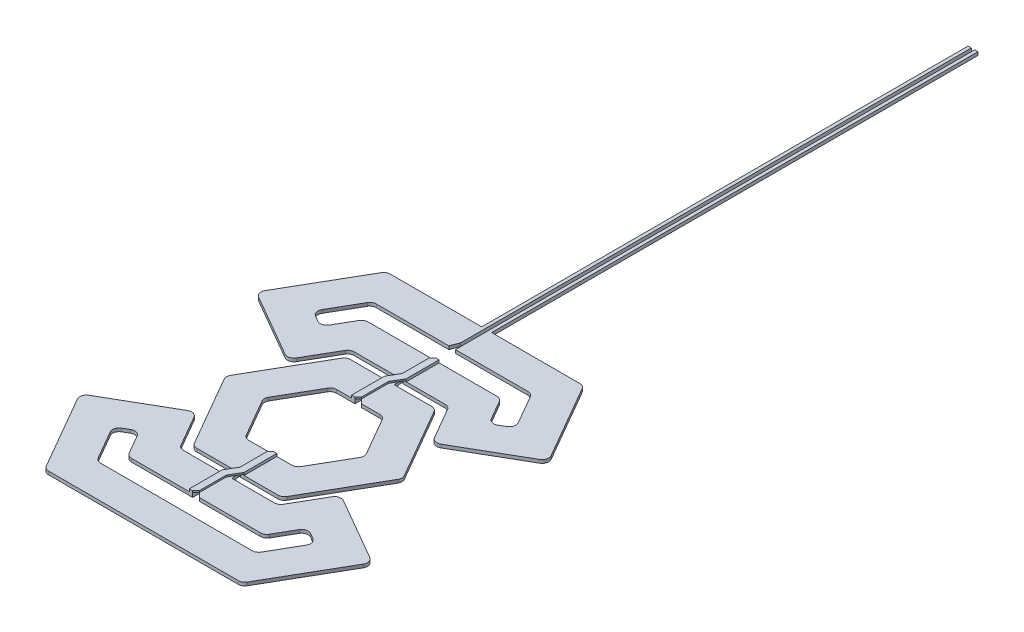
from build123d import *

# Parameters (mm, degrees)
EXTRUDE_1_DEPTH          = 1
EXTRUDE_1_2_DEPTH        = 1
EXTRUDE_1_3_DEPTH        = 1
CUT_EXTRUDE_2_DEPTH      = 3
CUT_EXTRUDE_2_DEPTH_BACK = 3
SKETCH_2_W               = 2
SKETCH_2_H               = 113.811945541
EXTRUDE_3_DEPTH          = 1
EXTRUDE_4_OUTLINE_W      = 1
EXTRUDE_4_OUTLINE_H      = 10
EXTRUDE_4_DEPTH          = 0.8
EXTRUDE_4_2_OUTLINE_W    = 1
EXTRUDE_4_2_OUTLINE_H    = 10
EXTRUDE_4_2_DEPTH        = 0.8
EXTRUDE_4_3_OUTLINE_W    = 1
EXTRUDE_4_3_OUTLINE_H    = 10
EXTRUDE_4_3_DEPTH        = 0.8
EXTRUDE_5_DEPTH          = 0.5
EXTRUDE_6_DEPTH          = 1
EXTRUDE_6_2_OUTLINE_W    = 1
EXTRUDE_6_2_OUTLINE_H    = 148.038475773
EXTRUDE_6_2_DEPTH        = 1


# Read off the part's stored shape, not the designer's step: 凸台-拉伸4, 凸台-拉伸6
with BuildPart() as part:
    # 草图1 → 凸台-拉伸1 (new body)
    with BuildSketch(Plane(origin=(0, 0, 0), x_dir=(1, 0, 0), z_dir=(0, 1, 0))):
        with BuildLine():
            Line((21, 15.588457268), (15.577350269, 24.980762114))
            ThreePointArc((15.577350269, 24.980762114), (14.845299462, 25.712812921), (13.845299462, 25.980762114))
            Line((13.845299462, 25.980762114), (-13.845299462, 25.980762114))
            ThreePointArc((-13.845299462, 25.980762114), (-14.845299462, 25.712812921), (-15.577350269, 24.980762114))
            Line((-15.577350269, 24.980762114), (-21, 15.588457268))
            ThreePointArc((-21, 15.588457268), (-22.214412717, 14.656605616), (-23.732050808, 14.856406461))
            Line((-23.732050808, 14.856406461), (-42.767949192, 25.846787517))
            ThreePointArc((-42.767949192, 25.846787517), (-43.699800845, 27.061200235), (-43.5, 28.578838325))
            Line((-43.5, 28.578838325), (-30.577350269, 50.961524227))
            ThreePointArc((-30.577350269, 50.961524227), (-29.845299462, 51.693575035), (-28.845299462, 51.961524227))
            Line((-28.845299462, 51.961524227), (28.845299462, 51.961524227))
            ThreePointArc((28.845299462, 51.961524227), (29.845299462, 51.693575035), (30.577350269, 50.961524227))
            Line((30.577350269, 50.961524227), (43.5, 28.578838325))
            ThreePointArc((43.5, 28.578838325), (43.699800845, 27.061200235), (42.767949192, 25.846787517))
            Line((42.767949192, 25.846787517), (23.732050808, 14.856406461))
            ThreePointArc((23.732050808, 14.856406461), (22.214412717, 14.656605616), (21, 15.588457268))
        make_face()
        with BuildLine():
            Line((23.07179677, 41.961524227), (-23.07179677, 41.961524227))
            ThreePointArc((-23.07179677, 41.961524227), (-24.07179677, 41.693575035), (-24.803847577, 40.961524227))
            Line((-24.803847577, 40.961524227), (-29.839745962, 32.239092363))
            ThreePointArc((-29.839745962, 32.239092363), (-30.039546807, 30.721454273), (-29.107695155, 29.507041555))
            Line((-29.107695155, 29.507041555), (-27.392304845, 28.516660498))
            ThreePointArc((-27.392304845, 28.516660498), (-25.874666755, 28.316859653), (-24.660254038, 29.248711306))
            Line((-24.660254038, 29.248711306), (-21.350852961, 34.980762114))
            ThreePointArc((-21.350852961, 34.980762114), (-20.618802154, 35.712812921), (-19.618802154, 35.980762114))
            Line((-19.618802154, 35.980762114), (19.618802154, 35.980762114))
            ThreePointArc((19.618802154, 35.980762114), (20.618802154, 35.712812921), (21.350852961, 34.980762114))
            Line((21.350852961, 34.980762114), (24.660254038, 29.248711306))
            ThreePointArc((24.660254038, 29.248711306), (25.874666755, 28.316859653), (27.392304845, 28.516660498))
            Line((27.392304845, 28.516660498), (29.107695155, 29.507041555))
            ThreePointArc((29.107695155, 29.507041555), (30.039546807, 30.721454273), (29.839745962, 32.239092363))
            Line((29.839745962, 32.239092363), (24.803847577, 40.961524227))
            ThreePointArc((24.803847577, 40.961524227), (24.07179677, 41.693575035), (23.07179677, 41.961524227))
        make_face(mode=Mode.SUBTRACT)
    extrude(amount=EXTRUDE_1_DEPTH)


with BuildPart() as body_2:
    # 草图1 → Extrude 1 2 (new body)
    with BuildSketch(Plane(origin=(0, 0, 0), x_dir=(1, 0, 0), z_dir=(0, 1, 0))):
        with BuildLine():
            Line((-43.5, -28.578838325), (-30.577350269, -50.961524227))
            ThreePointArc((-30.577350269, -50.961524227), (-29.845299462, -51.693575035), (-28.845299462, -51.961524227))
            Line((-28.845299462, -51.961524227), (28.845299462, -51.961524227))
            ThreePointArc((28.845299462, -51.961524227), (29.845299462, -51.693575035), (30.577350269, -50.961524227))
            Line((30.577350269, -50.961524227), (43.5, -28.578838325))
            ThreePointArc((43.5, -28.578838325), (43.699800845, -27.061200235), (42.767949192, -25.846787517))
            Line((42.767949192, -25.846787517), (23.732050808, -14.856406461))
            ThreePointArc((23.732050808, -14.856406461), (22.214412717, -14.656605616), (21, -15.588457268))
            Line((21, -15.588457268), (15.577350269, -24.980762114))
            ThreePointArc((15.577350269, -24.980762114), (14.845299462, -25.712812921), (13.845299462, -25.980762114))
            Line((13.845299462, -25.980762114), (-13.845299462, -25.980762114))
            ThreePointArc((-13.845299462, -25.980762114), (-14.845299462, -25.712812921), (-15.577350269, -24.980762114))
            Line((-15.577350269, -24.980762114), (-21, -15.588457268))
            ThreePointArc((-21, -15.588457268), (-22.214412717, -14.656605616), (-23.732050808, -14.856406461))
            Line((-23.732050808, -14.856406461), (-42.767949192, -25.846787517))
            ThreePointArc((-42.767949192, -25.846787517), (-43.699800845, -27.061200235), (-43.5, -28.578838325))
        make_face()
        with BuildLine():
            Line((-29.839745962, -32.239092363), (-24.803847577, -40.961524227))
            ThreePointArc((-24.803847577, -40.961524227), (-24.07179677, -41.693575035), (-23.07179677, -41.961524227))
            Line((-23.07179677, -41.961524227), (23.07179677, -41.961524227))
            ThreePointArc((23.07179677, -41.961524227), (24.07179677, -41.693575035), (24.803847577, -40.961524227))
            Line((24.803847577, -40.961524227), (29.839745962, -32.239092363))
            ThreePointArc((29.839745962, -32.239092363), (30.039546807, -30.721454273), (29.107695155, -29.507041555))
            Line((29.107695155, -29.507041555), (27.392304845, -28.516660498))
            ThreePointArc((27.392304845, -28.516660498), (25.874666755, -28.316859653), (24.660254038, -29.248711306))
            Line((24.660254038, -29.248711306), (21.350852961, -34.980762114))
            ThreePointArc((21.350852961, -34.980762114), (20.618802154, -35.712812921), (19.618802154, -35.980762114))
            Line((19.618802154, -35.980762114), (-19.618802154, -35.980762114))
            ThreePointArc((-19.618802154, -35.980762114), (-20.618802154, -35.712812921), (-21.350852961, -34.980762114))
            Line((-21.350852961, -34.980762114), (-24.660254038, -29.248711306))
            ThreePointArc((-24.660254038, -29.248711306), (-25.874666755, -28.316859653), (-27.392304845, -28.516660498))
            Line((-27.392304845, -28.516660498), (-29.107695155, -29.507041555))
            ThreePointArc((-29.107695155, -29.507041555), (-30.039546807, -30.721454273), (-29.839745962, -32.239092363))
        make_face(mode=Mode.SUBTRACT)
    extrude(amount=EXTRUDE_1_2_DEPTH)


with BuildPart() as body_3:
    # 草图1 → Extrude 1 3 (new body)
    with BuildSketch(Plane(origin=(0, 0, 0), x_dir=(1, 0, 0), z_dir=(0, 1, 0))):
        with BuildLine():
            Line((26.422649731, 1), (14.077350269, 22.382685902))
            ThreePointArc((14.077350269, 22.382685902), (13.345299462, 23.11473671), (12.345299462, 23.382685902))
            Line((12.345299462, 23.382685902), (-12.345299462, 23.382685902))
            ThreePointArc((-12.345299462, 23.382685902), (-13.345299462, 23.11473671), (-14.077350269, 22.382685902))
            Line((-14.077350269, 22.382685902), (-26.422649731, 1))
            ThreePointArc((-26.422649731, 1), (-26.690598923, 0), (-26.422649731, -1))
            Line((-26.422649731, -1), (-14.077350269, -22.382685902))
            ThreePointArc((-14.077350269, -22.382685902), (-13.345299462, -23.11473671), (-12.345299462, -23.382685902))
            Line((-12.345299462, -23.382685902), (12.345299462, -23.382685902))
            ThreePointArc((12.345299462, -23.382685902), (13.345299462, -23.11473671), (14.077350269, -22.382685902))
            Line((14.077350269, -22.382685902), (26.422649731, -1))
            ThreePointArc((26.422649731, -1), (26.690598923, 0), (26.422649731, 1))
        make_face()
        with BuildLine():
            Line((6.57179677, 13.382685902), (-6.57179677, 13.382685902))
            ThreePointArc((-6.57179677, 13.382685902), (-7.57179677, 13.11473671), (-8.303847577, 12.382685902))
            Line((-8.303847577, 12.382685902), (-14.875644347, 1))
            ThreePointArc((-14.875644347, 1), (-15.143593539, 0), (-14.875644347, -1))
            Line((-14.875644347, -1), (-8.303847577, -12.382685902))
            ThreePointArc((-8.303847577, -12.382685902), (-7.57179677, -13.11473671), (-6.57179677, -13.382685902))
            Line((-6.57179677, -13.382685902), (6.57179677, -13.382685902))
            ThreePointArc((6.57179677, -13.382685902), (7.57179677, -13.11473671), (8.303847577, -12.382685902))
            Line((8.303847577, -12.382685902), (14.875644347, -1))
            ThreePointArc((14.875644347, -1), (15.143593539, 0), (14.875644347, 1))
            Line((14.875644347, 1), (8.303847577, 12.382685902))
            ThreePointArc((8.303847577, 12.382685902), (7.57179677, 13.11473671), (6.57179677, 13.382685902))
        make_face(mode=Mode.SUBTRACT)
    extrude(amount=EXTRUDE_1_3_DEPTH)


with BuildPart() as cut_extrude_2_tool:
    # 草图2 → 切除-拉伸2 (new, two sides: drawn at the far end of the back side and taken through both)
    with BuildSketch(Plane(origin=(0, 0, 0), x_dir=(1, 0, 0), z_dir=(0, 1, 0)).offset(-CUT_EXTRUDE_2_DEPTH_BACK)):
        with Locations((0, 18.094027229)):
            Rectangle(SKETCH_2_W, SKETCH_2_H)
    extrude(amount=CUT_EXTRUDE_2_DEPTH + CUT_EXTRUDE_2_DEPTH_BACK)


with BuildPart() as part_1:
    add(part.part)

    # 切除-拉伸2: cut by cut_extrude_2_tool
    add(cut_extrude_2_tool.part, mode=Mode.SUBTRACT)



with BuildPart() as body_2_1:
    add(body_2.part)

    # 切除-拉伸2: cut by cut_extrude_2_tool
    add(cut_extrude_2_tool.part, mode=Mode.SUBTRACT)


with BuildPart() as body_3_1:
    add(body_3.part)

    # 切除-拉伸2: cut by cut_extrude_2_tool
    add(cut_extrude_2_tool.part, mode=Mode.SUBTRACT)


with BuildPart() as part_2:
    add(part_1.part)

    add(body_2_1.part)  # 凸台-拉伸3 merges body 2

    add(body_3_1.part)  # 凸台-拉伸3 merges body 3
    # 草图4 → 凸台-拉伸3 (add)
    with BuildSketch(Plane(origin=(0, 0, 0), x_dir=(1, 0, 0), z_dir=(0, 1, 0))):
        with BuildLine():
            Line((-1, 35.980762114), (0.31908507, 34.661677043))
            ThreePointArc((0.31908507, 34.661677043), (0.535857822, 34.337253695), (0.611978289, 33.954570262))
            Line((0.611978289, 33.954570262), (0.611978289, 25.696711517))
            ThreePointArc((0.611978289, 25.696711517), (0.615693763, 25.610588683), (0.626812574, 25.525105823))
            Line((0.626812574, 25.525105823), (1, 23.382685902))
            Line((1, 23.382685902), (1, 13.382685902))
            Line((1, 13.382685902), (-0.31908507, 14.701770972))
            ThreePointArc((-0.31908507, 14.701770972), (-0.535857822, 15.026194321), (-0.611978289, 15.408877754))
            Line((-0.611978289, 15.408877754), (-0.611978289, 23.666736499))
            ThreePointArc((-0.611978289, 23.666736499), (-0.615693763, 23.752859333), (-0.626812574, 23.838342193))
            Line((-0.626812574, 23.838342193), (-1, 25.980762114))
            Line((-1, 25.980762114), (-1, 35.980762114))
        make_face()
        with BuildLine():
            Line((1, -25.980762114), (1, -35.980762114))
            Line((1, -35.980762114), (-0.31908507, -34.661677043))
            ThreePointArc((-0.31908507, -34.661677043), (-0.535857822, -34.337253695), (-0.611978289, -33.954570262))
            Line((-0.611978289, -33.954570262), (-0.611978289, -25.696711517))
            ThreePointArc((-0.611978289, -25.696711517), (-0.615693763, -25.610588683), (-0.626812574, -25.525105823))
            Line((-0.626812574, -25.525105823), (-1, -23.382685902))
            Line((-1, -23.382685902), (-1, -13.382685902))
            Line((-1, -13.382685902), (0.31908507, -14.701770972))
            ThreePointArc((0.31908507, -14.701770972), (0.535857822, -15.026194321), (0.611978289, -15.408877754))
            Line((0.611978289, -15.408877754), (0.611978289, -23.666736499))
            ThreePointArc((0.611978289, -23.666736499), (0.615693763, -23.752859333), (0.626812574, -23.838342193))
            Line((0.626812574, -23.838342193), (1, -25.980762114))
        make_face()
    extrude(amount=EXTRUDE_3_DEPTH)

    # 凸台-拉伸4 outline → 凸台-拉伸4 (add)
    with BuildSketch(Plane(origin=(0, 1, 0), x_dir=(1, 0, 0), z_dir=(0, 1, 0))):
        with Locations((1.5, 30.980762114)):
            Rectangle(EXTRUDE_4_OUTLINE_W, EXTRUDE_4_OUTLINE_H)
    extrude(amount=EXTRUDE_4_DEPTH)

    # Extrude 4 3 outline → Extrude 4 3 (add)
    with BuildSketch(Plane(origin=(0, 1, 0), x_dir=(1, 0, 0), z_dir=(0, 1, 0))):
        with Locations((-1.5, -30.980762114)):
            Rectangle(EXTRUDE_4_3_OUTLINE_W, EXTRUDE_4_3_OUTLINE_H)
        with Locations((-1.5, 18.382685902)):
            Rectangle(EXTRUDE_4_3_OUTLINE_W, EXTRUDE_4_3_OUTLINE_H)
    extrude(amount=EXTRUDE_4_3_DEPTH)

    # 草图6 → 凸台-拉伸5 (add)
    with BuildSketch(Plane(origin=(0, 1.3, 0), x_dir=(1, 0, 0), z_dir=(0, 1, 0))):
        with BuildLine():
            Line((1, 35.980762114), (0, 34.980762114))
            Line((0, 34.980762114), (0, 27.041142723))
            ThreePointArc((0, 27.041142723), (-0.035386197, 26.777475868), (-0.139040421, 26.532469347))
            Line((-0.139040421, 26.532469347), (-2, 23.382685902))
            Line((-2, 23.382685902), (-1, 23.382685902))
            Line((-1, 23.382685902), (-1, 13.382685902))
            Line((-1, 13.382685902), (0, 14.382685902))
            Line((0, 14.382685902), (0, 22.322305293))
            ThreePointArc((0, 22.322305293), (0.035386197, 22.585972148), (0.139040421, 22.830978668))
            Line((0.139040421, 22.830978668), (2, 25.980762114))
            Line((2, 25.980762114), (1, 25.980762114))
            Line((1, 25.980762114), (1, 35.980762114))
        make_face()
        with BuildLine():
            Line((0, -14.382685902), (0, -22.322305293))
            ThreePointArc((0, -22.322305293), (-0.035386197, -22.585972148), (-0.139040421, -22.830978668))
            Line((-0.139040421, -22.830978668), (-2, -25.980762114))
            Line((-2, -25.980762114), (-1, -25.980762114))
            Line((-1, -25.980762114), (-1, -35.980762114))
            Line((-1, -35.980762114), (0, -34.980762114))
            Line((0, -34.980762114), (0, -27.041142723))
            ThreePointArc((0, -27.041142723), (0.035386197, -26.777475868), (0.139040421, -26.532469347))
            Line((0.139040421, -26.532469347), (2, -23.382685902))
            Line((2, -23.382685902), (1, -23.382685902))
            Line((1, -23.382685902), (1, -13.382685902))
            Line((1, -13.382685902), (0, -14.382685902))
        make_face()
    extrude(amount=EXTRUDE_5_DEPTH)

    # 凸台-拉伸6 outline → 凸台-拉伸6 (add)
    with BuildSketch(Plane(origin=(0, 0, 0), x_dir=(1, 0, 0), z_dir=(0, 1, 0))):
        with BuildLine():
            Line((-1, 200), (-1, 41.961524227))
            Line((-1, 41.961524227), (-0.067124556, 44.377567314))
            ThreePointArc((-0.067124556, 44.377567314), (-0.016924356, 44.55456633), (0, 44.737766434))
            Line((0, 44.737766434), (0, 200))
            Line((0, 200), (-1, 200))
        make_face()
    extrude(amount=EXTRUDE_6_DEPTH)


with BuildPart() as body_2_2:
    # Extrude 4 2 outline → Extrude 4 2 (new body)
    with BuildSketch(Plane(origin=(0, 1, 0), x_dir=(1, 0, 0), z_dir=(0, 1, 0))):
        with Locations((1.5, -18.382685902)):
            Rectangle(EXTRUDE_4_2_OUTLINE_W, EXTRUDE_4_2_OUTLINE_H)
    extrude(amount=EXTRUDE_4_2_DEPTH)


with BuildPart() as body_3_2:
    # Extrude 6 2 outline → Extrude 6 2 (new body)
    with BuildSketch(Plane(origin=(0, 0, 0), x_dir=(1, 0, 0), z_dir=(0, 1, 0))):
        with Locations((1.5, 125.980762114)):
            Rectangle(EXTRUDE_6_2_OUTLINE_W, EXTRUDE_6_2_OUTLINE_H)
    extrude(amount=EXTRUDE_6_2_DEPTH)


with BuildPart() as body_2_2_1:
    add(body_2_2.part)

    # Combine 2: union part, body 3 2
    add(part_2.part)
    add(body_3_2.part)


solid = body_2_2_1.part
